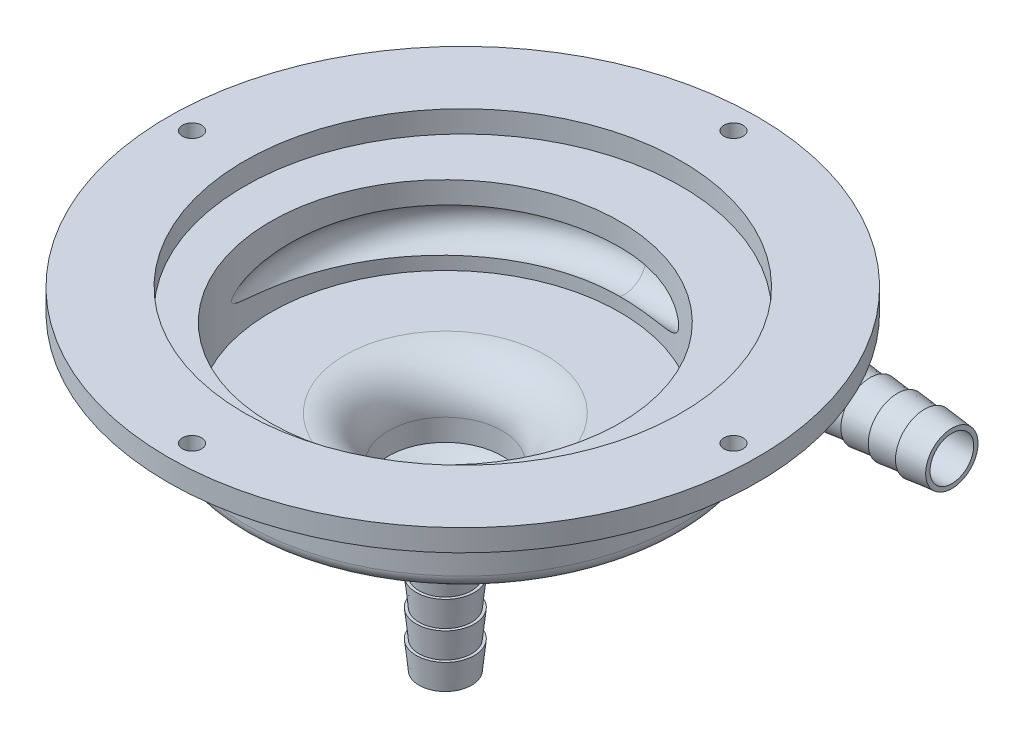
from build123d import *

# Parameters (mm, degrees)
SKETCH1_R                = 50
SKETCH1_R_2              = 40
BOSS_EXTRUDE1_DEPTH      = 20
BOSS_EXTRUDE2_DEPTH      = 2
BOSS_EXTRUDE2_DEPTH_BACK = 4
SKETCH2_R                = 40
SKETCH3_R                = 67.5
SKETCH3_R_2              = 50
SKETCH3_R_3              = 2.200000000003341
SKETCH3_R_4              = 2.2000000000033366
BOSS_EXTRUDE3_DEPTH      = 5
SKETCH4_R                = 5.999999999999995
SKETCH4_R_2              = 4.750000000000005
SKETCH7_R                = 4.9999999999999964
SKETCH9_R                = 15
BOSS_EXTRUDE5_DEPTH      = 15
SKETCH10_R               = 5.5
BOSS_EXTRUDE6_DEPTH      = 4.999999999999999
SKETCH11_R               = 4.5
CUT_EXTRUDE1_DEPTH       = 108.3009785603095
SKETCH12_R               = 13.000000000000004
CUT_EXTRUDE2_DEPTH       = 15
FILLET1_R                = 10
FILLET2_R                = 3
CUT_EXTRUDE3_START       = -25
SKETCH14_R               = 4.9999999999999964
CUT_EXTRUDE3_DEPTH       = 25
CUT_EXTRUDE4_START       = -29.235639
SKETCH16_R               = 5.000000000000001
CUT_EXTRUDE4_DEPTH       = 29.235639


with BuildPart() as part:
    # Sketch1 → Boss-Extrude1 (new body)
    with BuildSketch(Plane(origin=(0, 0, 0), x_dir=(1, 0, 0), z_dir=(0, 1, 0))):
        with Locations(Location((0, 0, 0), (0, 0, 270))):
            Circle(SKETCH1_R)
        with Locations(Location((0, -4, 0), (0, 0, 270))):
            Circle(SKETCH1_R_2, mode=Mode.SUBTRACT)
    extrude(amount=BOSS_EXTRUDE1_DEPTH)

    # Sketch2 → Boss-Extrude2 (add, two sides: drawn at the far end of the back side and taken through both)
    with BuildSketch(Plane(origin=(0, 0, 0), x_dir=(1, 0, 0), z_dir=(0, 1, 0)).offset(-BOSS_EXTRUDE2_DEPTH_BACK)):
        with Locations(Location((0, -4, 0), (0, 0, 270))):
            Circle(SKETCH2_R)
    extrude(amount=BOSS_EXTRUDE2_DEPTH + BOSS_EXTRUDE2_DEPTH_BACK)

    # Sweep1: sweep along a path in Sketch5
    with BuildLine(Plane(origin=(0, 0, 0), x_dir=(1, 0, 0), z_dir=(0, 1, 0))) as sweep1_path:
        Line((50, 37), (19.856529596382096, 37))
    # Sketch4 → Sweep1 (sweep)
    with BuildSketch(Plane(origin=(50, 0, 0), x_dir=(0, 0, -1), z_dir=(1, 0, 0))):
        with Locations((37, 10)):
            Circle(SKETCH4_R)
        with Locations((37, 10)):
            Circle(SKETCH4_R_2, mode=Mode.SUBTRACT)
    sweep(path=sweep1_path.line)

    # Cut-Sweep4: sweep along a path in Sketch6
    with BuildLine(Plane(origin=(0, 0, 0), x_dir=(1, 0, 0), z_dir=(0, 1, 0))) as cut_sweep4_path:
        Line((50, 41), (0, 41))
        ThreePointArc((0, 41), (-39.04316241903396, 11.041127779829239), (-20.210228030153765, -34.42559784108742))
    # Sketch7 → Cut-Sweep4 (sweep, cut)
    with BuildSketch(Plane(origin=(50, 0, 0), x_dir=(0, 0, -1), z_dir=(1, 0, 0))):
        with Locations((37, 10)):
            Circle(SKETCH7_R)
    sweep(path=cut_sweep4_path.line, mode=Mode.SUBTRACT)

    # Sketch9 → Boss-Extrude5 (add)
    with BuildSketch(Plane.XZ.offset(4)):
        with Locations(Location((0, 4, 0), (0, 0, 270))):
            Circle(SKETCH9_R)
    extrude(amount=BOSS_EXTRUDE5_DEPTH)

    # Sketch10 → Boss-Extrude6 (add)
    with BuildSketch(Plane.XZ.offset(19)):
        with Locations(Location((0, 4, 0), (0, 0, 270))):
            Circle(SKETCH10_R)
    extrude(amount=BOSS_EXTRUDE6_DEPTH)

    # Sketch11 → Cut-Extrude1 (cut, through all)
    with BuildSketch(Plane.XZ.offset(24)):
        with Locations(Location((0, 4, 0), (0, 0, 270))):
            Circle(SKETCH11_R)
    extrude(amount=-CUT_EXTRUDE1_DEPTH, mode=Mode.SUBTRACT)

    # Sketch12 → Cut-Extrude2 (cut)
    with BuildSketch(Plane(origin=(0, 2, 0), x_dir=(1, 0, 0), z_dir=(0, 1, 0))):
        with Locations(Location((0, -4, 0), (0, 0, 270))):
            Circle(SKETCH12_R)
    extrude(amount=-CUT_EXTRUDE2_DEPTH, mode=Mode.SUBTRACT)

    # Fillet1
    # the kernel refuses this fillet: 10 mm, written as the material it takes off along each edge
    with BuildSketch(Plane(origin=(0, 2, 4), x_dir=(-1.8e-16, 0, 1), z_dir=(-1, 0, -1.8e-16))) as fillet1_piece_1:
        with BuildLine():
            CenterArc((13.000000000000004 + FILLET1_R, -FILLET1_R), FILLET1_R, 90, 90)
            Line((13, -FILLET1_R), (13.000000000000004 - FILLET1_R * 0.02, -FILLET1_R))
            Line((13.000000000000004 - FILLET1_R * 0.02, -FILLET1_R), (13.000000000000004 - FILLET1_R * 0.02, FILLET1_R * 0.02))
            Line((13.000000000000004 - FILLET1_R * 0.02, FILLET1_R * 0.02), (13.000000000000004 + FILLET1_R, FILLET1_R * 0.02))
            Line((13.000000000000004 + FILLET1_R, FILLET1_R * 0.02), (13.000000000000004 + FILLET1_R, 0))
        make_face()
    revolve(axis=Axis((0, 2, 4), (0, 1, 0)), mode=Mode.SUBTRACT)
    with BuildSketch(Plane(origin=(0, -13, 4), x_dir=(-1.8e-16, 0, -1), z_dir=(-1, 0, 1.8e-16))) as fillet1_piece_2:
        with BuildLine():
            CenterArc((14.5, 9.886859966642746), FILLET1_R, 180, 81.37307344132148)
            Line((4.5, 9.886859966642746), (4.3, 9.886859966642746))
            Line((4.3, 9.886859966642746), (4.3, 0))
            Line((4.3, 0), (4.5, -0.1999999999999993))
            ThreePointArc((4.5, -0.1999999999999993), (8.75000000000001, -0.1999999999999993), (12.970000000000026, -0.19773719933270506))
            Line((12.970000000000026, -0.19773719933270506), (13.000000000000025, 1.4744e-13))
        make_face()
    revolve(axis=Axis((0, -13, 4), (0, -1, 0)), mode=Mode.SUBTRACT)

    # Fillet2
    fillet2_edges = [part.edges().sort_by_distance(p)[0] for p in [
        (1.225e-14, -4, -36),
        (1.531e-14, 0, -50),
        (1.125e-14, -19, 19),
    ]]
    fillet(fillet2_edges, radius=FILLET2_R)

    # Sketch13 → Revolve1 (revolve)
    with BuildSketch(Plane.XY.offset(-37), mode=Mode.PRIVATE) as revolve1_sk:
        Polygon((50, 9.999999999999998), (50, 3.9999999999999654), (50, 3.3499999999999677), (56.250000000000036, 3.9999999999999516), (56.250000000000036, 3.349999999999967), (62.500000000000014, 3.999999999999949), (62.500000000000014, 3.349999999999964), (68.74999999999999, 3.9999999999999463), (68.74999999999999, 3.3499999999999623), (75, 3.9999999999999445), (75, 9.999999999999998), align=None)
    revolve(revolve1_sk.sketch.rotate(Axis((50, 9.999999999999998, -37), (1, 0, 0)), 270), axis=Axis((50, 9.999999999999998, -37), (1, 0, 0)))

    # Sketch14 → Cut-Extrude3 (cut)
    with BuildSketch(Plane(origin=(75, 0, 0), x_dir=(0, 0, -1), z_dir=(1, 0, 0)).offset(CUT_EXTRUDE3_START)):
        with Locations(Location((37, 9.999999999999998, 0), (0, 0, 258.463040967))):
            Circle(SKETCH14_R)
    extrude(amount=CUT_EXTRUDE3_DEPTH, mode=Mode.SUBTRACT)

    # Sketch15 → Revolve2 (revolve)
    with BuildSketch(Plane.XY.offset(4)):
        Polygon((0, -23.999999999999996), (-6.00000000000004, -23.999999999999975), (-6.650000000000038, -24.00000000000012), (-6.000000000000082, -30.25000000000008), (-6.650000000000052, -30.250000000000153), (-6.000000000000089, -36.499999999999986), (-6.650000000000072, -36.499999999999986), (-6.000000000000116, -42.74999999999996), (-6.6500000000001, -42.74999999999996), (-6.000000000000137, -48.99999999999996), (-8.327e-14, -48.99999999999999), align=None)
    revolve(axis=Axis((5.43e-15, -24.00000000000014, 4), (3.49e-15, 1, 0)))

    # Sketch16 → Cut-Extrude4 (cut)
    with BuildSketch(Plane.XZ.offset(48.99999999999998).offset(CUT_EXTRUDE4_START)):
        with Locations((1.2406e-13, 4)):
            Circle(SKETCH16_R)
    extrude(amount=CUT_EXTRUDE4_DEPTH, mode=Mode.SUBTRACT)


with BuildPart() as body_2:
    # Sketch3 → Boss-Extrude3 (new body)
    with BuildSketch(Plane(origin=(0, 20, 0), x_dir=(1, 0, 0), z_dir=(0, 1, 0))):
        with Locations(Location((0, 0, 0), (0, 0, 270))):
            Circle(SKETCH3_R)
        with Locations(Location((0, 0, 0), (0, 0, 270))):
            Circle(SKETCH3_R_2, mode=Mode.SUBTRACT)
        with Locations(Location((0, 62, 0), (0, 0, 270))):
            Circle(SKETCH3_R_3, mode=Mode.SUBTRACT)
        with Locations(Location((62.000000000001556, 1.55352e-12, 0), (0, 0, 270))):
            Circle(SKETCH3_R_4, mode=Mode.SUBTRACT)
        with Locations(Location((3.10704e-12, -62, 0), (0, 0, 270))):
            Circle(SKETCH3_R_3, mode=Mode.SUBTRACT)
        with Locations(Location((-61.99999999999845, -1.56111e-12, 0), (0, 0, 270))):
            Circle(SKETCH3_R_4, mode=Mode.SUBTRACT)
    extrude(amount=BOSS_EXTRUDE3_DEPTH)


solid = Compound([part.part, body_2.part])
